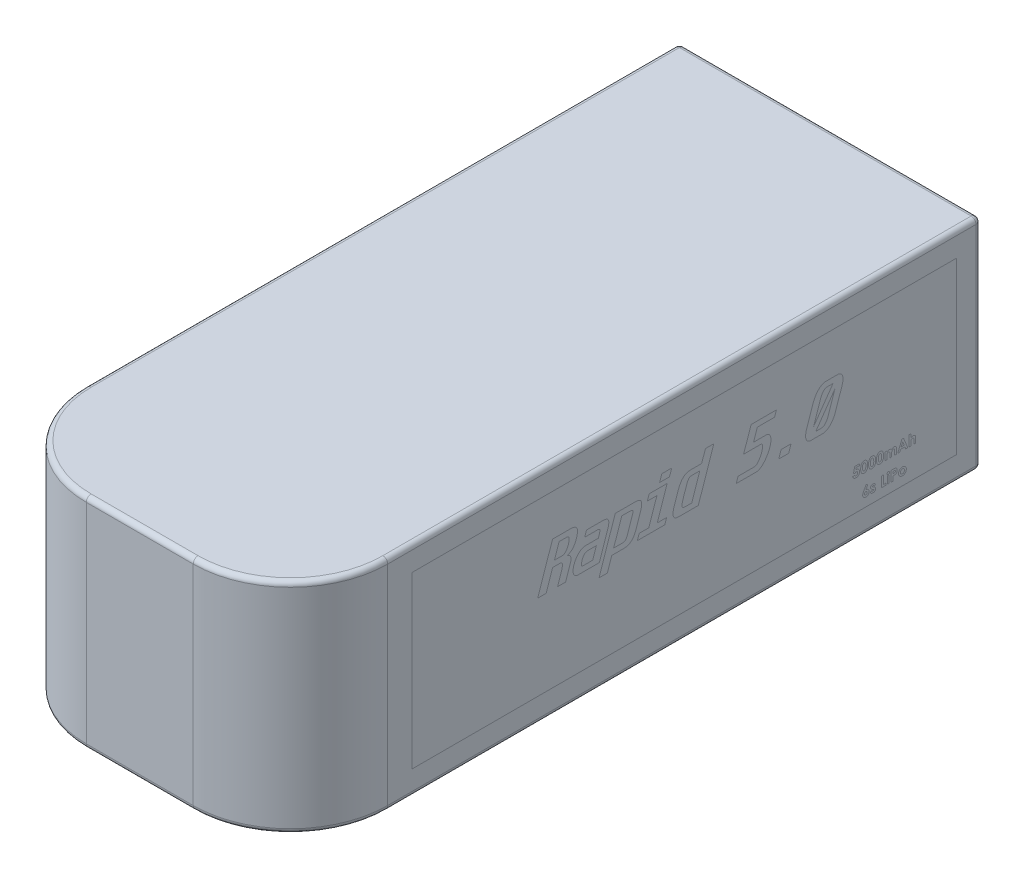
from build123d import *

# Parameters (mm, degrees)
SKETCH1_W           = 62
SKETCH1_H           = 45
BOSS_EXTRUDE1_DEPTH = 142
FILLET1_R           = 20
FILLET2_R           = 1


with BuildPart() as part:
    # Sketch1 → Boss-Extrude1 (new body)
    with BuildSketch(Plane.XY):
        Rectangle(SKETCH1_W, SKETCH1_H)
    extrude(amount=BOSS_EXTRUDE1_DEPTH)

    # Fillet1
    fillet1_edges = [part.edges().sort_by_distance(p)[0] for p in [
        (-31, 0, 142),
        (31, 0, 142),
    ]]
    fillet(fillet1_edges, radius=FILLET1_R)

    # Fillet2
    fillet2_edges = [part.edges().sort_by_distance(p)[0] for p in [
        (-31, -22.5, 61),
        (-25.142135624, -22.5, 136.142135624),
        (0, -22.5, 142),
        (25.142135624, -22.5, 136.142135624),
        (-31, 22.5, 61),
        (-25.142135624, 22.5, 136.142135624),
        (0, 22.5, 142),
        (25.142135624, 22.5, 136.142135624),
        (-31, 0, 0),
        (0, -22.5, 0),
        (31, -22.5, 61),
        (31, 0, 0),
        (31, 22.5, 61),
        (0, 22.5, 0),
    ]]
    fillet(fillet2_edges, radius=FILLET2_R)


solid = part.part
